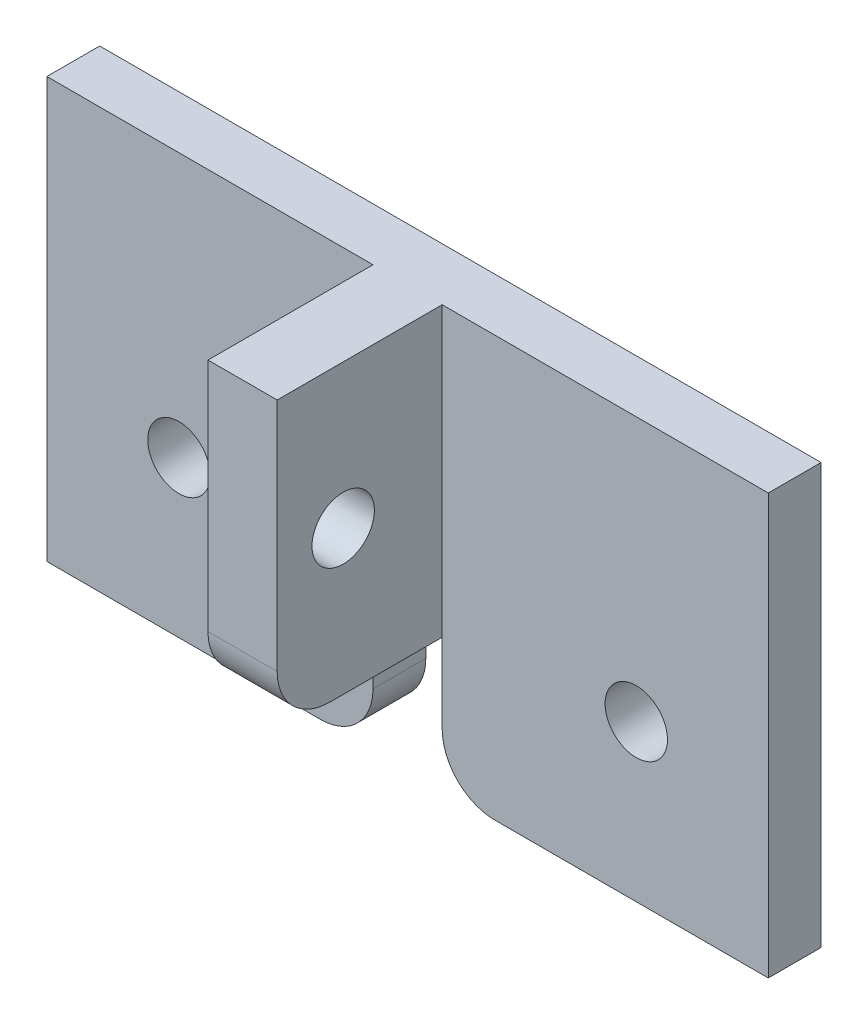
from build123d import *

# Parameters (mm, degrees)
SKETCH1_R           = 1.5
BOSS_EXTRUDE1_DEPTH = 2.54
SKETCH2_W           = 3.3274
SKETCH2_H           = 13.8539982
BOSS_EXTRUDE2_DEPTH = 7.9375
SKETCH3_R           = 1.5
CUT_EXTRUDE1_DEPTH  = 24.944710893
FILLET1_R           = 2.54
FILLET3_R           = 2.54


with BuildPart() as part:
    # Sketch1 → Boss-Extrude1 (new body)
    with BuildSketch(Plane.XY):
        Polygon((17.35, 10.1019991), (-17.35, 10.1019991), (-17.35, -10.1019991), (-1.6637, -10.1019991), (-1.6637, -3.7519991), (1.6637, -3.7519991), (1.6637, -10.1019991), (17.35, -10.1019991), align=None)
        with Locations((-11, -2.5980009)):
            Circle(SKETCH1_R, mode=Mode.SUBTRACT)
        with Locations((11, -2.5980009)):
            Circle(SKETCH1_R, mode=Mode.SUBTRACT)
    extrude(amount=BOSS_EXTRUDE1_DEPTH)

    # Sketch2 → Boss-Extrude2 (add)
    with BuildSketch(Plane.XY.offset(2.54)):
        with Locations((0, 3.175)):
            Rectangle(SKETCH2_W, SKETCH2_H)
    extrude(amount=BOSS_EXTRUDE2_DEPTH)

    # Sketch3 → Cut-Extrude1 (cut, through all)
    with BuildSketch(Plane.ZY.offset(1.6637)):
        with Locations((7.3025, 3.175)):
            Circle(SKETCH3_R)
    extrude(amount=-CUT_EXTRUDE1_DEPTH, mode=Mode.SUBTRACT)

    # Fillet1
    fillet1_edges = [part.edges().sort_by_distance(p)[0] for p in [
        (0, -3.7519991, 10.4775),
    ]]
    fillet(fillet1_edges, radius=FILLET1_R)

    # Fillet3
    fillet3_edges = [part.edges().sort_by_distance(p)[0] for p in [
        (1.6637, -10.1019991, 1.27),
        (-1.6637, -10.1019991, 1.27),
    ]]
    fillet(fillet3_edges, radius=FILLET3_R)


solid = part.part
